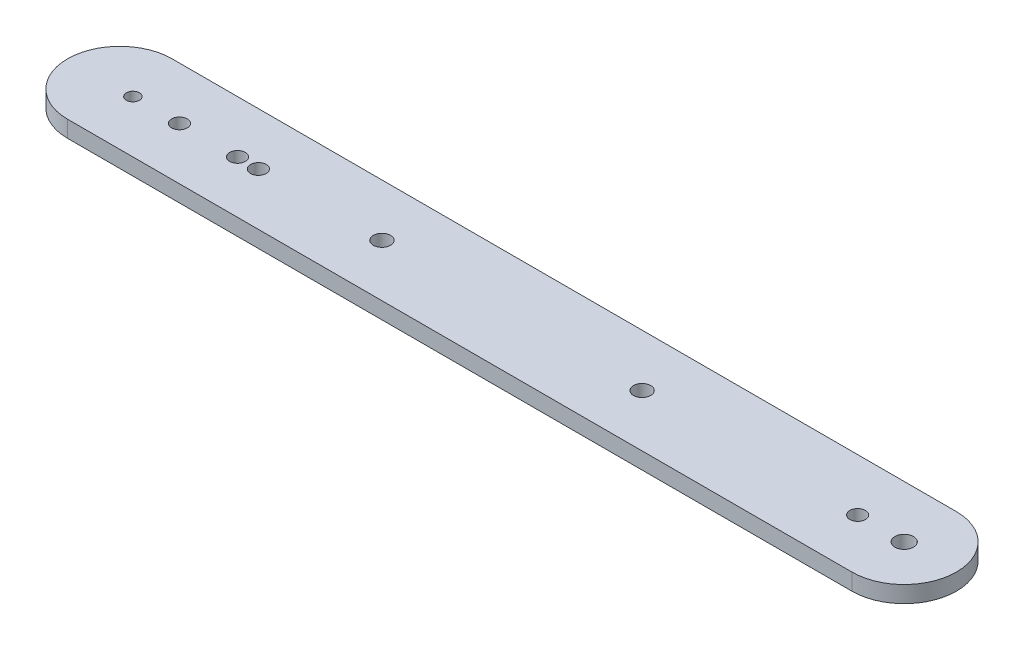
from build123d import *

# Parameters (mm, degrees)
SKETCH1_R           = 1.5
SKETCH1_R_2         = 1.775813941
SKETCH1_R_3         = 1.65
SKETCH1_R_4         = 1.25
BOSS_EXTRUDE1_DEPTH = 3.175


with BuildPart() as part:
    # Sketch1 → Boss-Extrude1 (new body)
    with BuildSketch(Plane(origin=(0, 0, 0), x_dir=(1, 0, 0), z_dir=(0, 1, 0))):
        with BuildLine():
            Line((-75, 7.5), (75, 7.5))
            ThreePointArc((75, 7.5), (85, -2.5), (75, -12.5))
            Line((75, -12.5), (-75, -12.5))
            ThreePointArc((-75, -12.5), (-85, -2.5), (-75, 7.5))
        make_face()
        with Locations((-63.6, -2.5)):
            Circle(SKETCH1_R, mode=Mode.SUBTRACT)
        with Locations((-52.5, -2.5)):
            Circle(SKETCH1_R, mode=Mode.SUBTRACT)
        with Locations((-48.5, -2.5)):
            Circle(SKETCH1_R, mode=Mode.SUBTRACT)
        with Locations((66.1, -2.5)):
            Circle(SKETCH1_R, mode=Mode.SUBTRACT)
        with Locations((75, -2.5)):
            Circle(SKETCH1_R_2, mode=Mode.SUBTRACT)
        with Locations((24.874685928, -2.5)):
            Circle(SKETCH1_R_3, mode=Mode.SUBTRACT)
        with Locations((-24.874685928, -2.5)):
            Circle(SKETCH1_R_3, mode=Mode.SUBTRACT)
        with Locations((-72.5, -2.5)):
            Circle(SKETCH1_R_4, mode=Mode.SUBTRACT)
    extrude(amount=BOSS_EXTRUDE1_DEPTH)


solid = part.part
